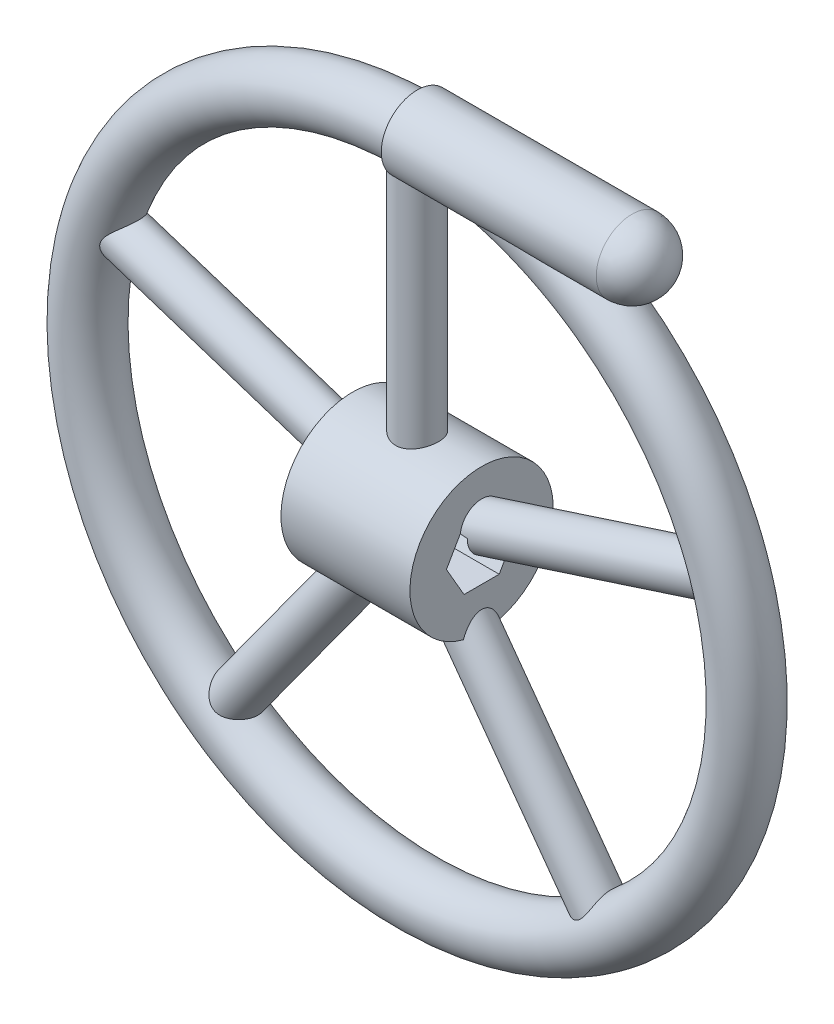
from build123d import *
from build123d.topology import SkipClean

# Parameters (mm, degrees)
SKETCH_1_R               = 8
SWEEP_2_PROFILE_R        = 6
PATTERN_CIRCULAR_1_COUNT = 5
EXTRUDE_START            = -18
EXTRUDE_3_OUTLINE_R      = 20
EXTRUDE_3_DEPTH          = 36
CUT_EXTRUDE_1_DEPTH      = 20


# Read off the part's stored shape, not the designer's step: 凸台-拉伸3
with BuildPart() as part:
    # 草图1 → 旋转1 (revolve)
    with BuildSketch(Plane(origin=(0, 0, 0), x_dir=(0, 0, -1), z_dir=(1, 0, 0)), mode=Mode.PRIVATE) as revolve_1_sk:
        with Locations((0, 92)):
            Circle(SKETCH_1_R)
    revolve(revolve_1_sk.sketch.rotate(Axis((0, 0, 0), (0, 0, 1)), 90), axis=Axis((0, 0, 0), (0, 0, 1)))

    # 扫描2: sweep along a curve in space
    with SkipClean():  # the faces are left unmerged after this step: merging them gives an invalid solid
        with BuildLine() as sweep_2_path:
            Line((0, 10, 0), (0, 92, 0))
        # 扫描2 profile (on start of the path) → 扫描2 (sweep)
        with BuildSketch(Plane.ZX.offset(10)):
            Circle(SWEEP_2_PROFILE_R)
        sweep_2 = sweep(path=sweep_2_path.line)

    # 阵列(圆周)1: 扫描2 ×5 about axis
    with SkipClean():  # the faces are left unmerged after this step: merging them gives an invalid solid
        pattern_circular_1_axis = Axis((0, 0, 0), (0, 0, 1))
        for i in range(1, PATTERN_CIRCULAR_1_COUNT):
            add(sweep_2.rotate(pattern_circular_1_axis, i * 360 / PATTERN_CIRCULAR_1_COUNT))

    # 凸台-拉伸3 outline → 凸台-拉伸3 (add)
    with SkipClean():  # the faces are left unmerged after this step: merging them gives an invalid solid
        with BuildSketch(Plane(origin=(0, 0, 0), x_dir=(0, 0, -1), z_dir=(1, 0, 0)).offset(EXTRUDE_START)):
            Circle(EXTRUDE_3_OUTLINE_R)
        extrude(amount=EXTRUDE_3_DEPTH)

    # 草图19 → 旋转2 (revolve)
    with BuildSketch(Plane.XY, mode=Mode.PRIVATE) as revolve_2_sk:
        with BuildLine():
            Line((0, 92), (0, 102))
            Line((0, 102), (60, 102))
            ThreePointArc((60, 102), (67.0711, 99.0711), (70, 92))
            Line((70, 92), (0, 92))
        make_face()
    revolve(revolve_2_sk.sketch.rotate(Axis((0, 92, 0), (1, 0, 0)), 90), axis=Axis((0, 92, 0), (1, 0, 0)))

    # 草图20 → 切除-拉伸1 (cut, symmetric)
    with BuildSketch(Plane(origin=(0, 0, 0), x_dir=(0, 0, -1), z_dir=(1, 0, 0))):
        Polygon((-9.814954576, 0), (-4.907477288, 8.5), (4.907477288, 8.5), (9.814954576, 0), (4.907477288, -8.5), (-4.907477288, -8.5), align=None)
    extrude(amount=CUT_EXTRUDE_1_DEPTH, both=True, mode=Mode.SUBTRACT)


solid = part.part
